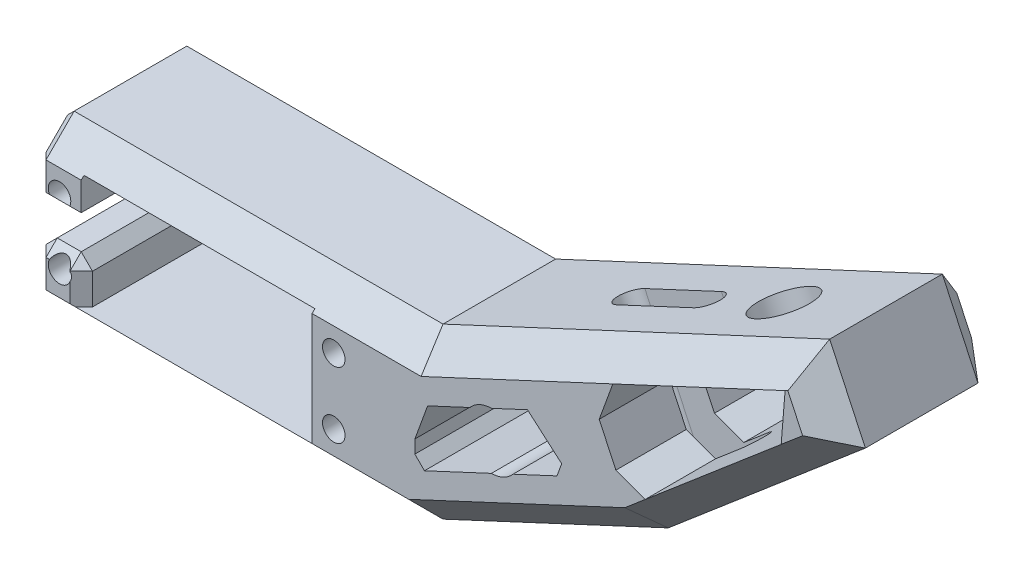
from build123d import *
from OCP.BRepFilletAPI import BRepFilletAPI_MakeChamfer

# Parameters (mm, degrees)
SKETCH1_W           = 57.5
SKETCH1_H           = 30
BOSS_EXTRUDE1_DEPTH = 30
SKETCH2_W           = 41
SKETCH2_H           = 21
CUT_EXTRUDE1_DEPTH  = 25
SKETCH8_R           = 2
CUT_EXTRUDE6_DEPTH  = 10
SKETCH9_W           = 8.25
SKETCH9_H           = 6
CUT_EXTRUDE7_DEPTH  = 25
SKETCH10_R          = 5
CUT_EXTRUDE8_DEPTH  = 10
BOSS_EXTRUDE4_DEPTH = 30
CUT_EXTRUDE9_DEPTH  = 30
CHAMFER3_SIZE       = 5
CHAMFER3_SIZE_2     = 7.15419636
CHAMFER3_SIZE_3     = 4.066852786
SKETCH16_R          = 5
CUT_EXTRUDE10_DEPTH = 30
CHAMFER5_SIZE       = 5
CHAMFER6_SIZE       = 2
CHAMFER7_SIZE       = 2.5
CHAMFER7_SIZE_2     = 1.767766953
CHAMFER8_SIZE       = 2.5
CHAMFER8_SIZE2      = 1.892599607
CHAMFER8_SIZE2_2    = 1.881218298
CHAMFER8_SIZE2_3    = 5.168604796
SKETCH19_R          = 5
CUT_EXTRUDE12_DEPTH = 30
SKETCH20_R          = 7.5
CUT_EXTRUDE13_DEPTH = 2.5


with BuildPart() as part:
    # Sketch1 → Boss-Extrude1 (new body)
    with BuildSketch(Plane.XY):
        Rectangle(SKETCH1_W, SKETCH1_H)
    extrude(amount=BOSS_EXTRUDE1_DEPTH)

    # Sketch2 → Cut-Extrude1 (cut)
    with BuildSketch(Plane.XY.offset(30)):
        Rectangle(SKETCH2_W, SKETCH2_H)
    extrude(amount=-CUT_EXTRUDE1_DEPTH, mode=Mode.SUBTRACT)

    # Sketch8 → Cut-Extrude6 (cut)
    with BuildSketch(Plane.XY.offset(30)):
        with Locations((24.35, 5.85)):
            Circle(SKETCH8_R)
        with Locations(Location((24.35, -5.85, 0), (0, 0, 180))):
            Circle(SKETCH8_R)
        with Locations((-24.35, -5.85)):
            Circle(SKETCH8_R)
        with Locations(Location((-24.35, 5.85, 0), (0, 0, 180))):
            Circle(SKETCH8_R)
    extrude(amount=-CUT_EXTRUDE6_DEPTH, mode=Mode.SUBTRACT)

    # Sketch9 → Cut-Extrude7 (cut)
    with BuildSketch(Plane.XY.offset(30)):
        with Locations((-24.625, 0)):
            Rectangle(SKETCH9_W, SKETCH9_H)
    extrude(amount=-CUT_EXTRUDE7_DEPTH, mode=Mode.SUBTRACT)

    # Sketch10 → Cut-Extrude8 (cut)
    with BuildSketch(Plane.XY.offset(5)):
        with Locations((-10, 0)):
            Circle(SKETCH10_R)
    extrude(amount=-CUT_EXTRUDE8_DEPTH, mode=Mode.SUBTRACT)

    # Sketch13 → Boss-Extrude4 (add)
    with BuildSketch(Plane.XY.offset(30)):
        Polygon((28.75, 15), (38.75, 15), (107.410726074, 47.017022383), (113.75, 33.422405577), (78.75, 3.652306326), (38.75, -15), (28.75, -15), align=None)
    extrude(amount=-BOSS_EXTRUDE4_DEPTH)

    # Sketch15 → Cut-Extrude9 (cut)
    with BuildSketch(Plane.XY.offset(30)):
        Polygon((38.75, 5), (38.75, 0), (38.75, -5), (66.25, 7.823460599), (58.75, 14.326153163), align=None)
        Polygon((76.558385836, 8.352238067), (69.372424662, 23.762581536), (104.992278447, 40.372392139), (107.608239852, 34.762444803), align=None)
    extrude(amount=-CUT_EXTRUDE9_DEPTH, mode=Mode.SUBTRACT)

    # Chamfer3
    # the kernel refuses this chamfer: 7.15419636, 5, 4.066852786 mm, written as the material it adds along each edge
    with BuildSketch(Plane(origin=(107.608239852, 34.762444803, 30), x_dir=(-0.7359660221939145, -0.6770184740286387, 0), z_dir=(0, 0, -1))) as chamfer3_piece_1:
        Polygon((CHAMFER3_SIZE * 0.999244403531, CHAMFER3_SIZE * 0.0388667211355), (-CHAMFER3_SIZE_2 * 0.302554433968, CHAMFER3_SIZE_2 * 0.953132107531), (0, 0), align=None)
    extrude(amount=30)
    with BuildSketch(Plane(origin=(69.372424662, 23.762581536, 30), x_dir=(0.8943448678110075, 0.4473782040065334, 0), z_dir=(0, 0, -1))) as chamfer3_piece_2:
        Polygon((CHAMFER3_SIZE * 0.999621916911, CHAMFER3_SIZE * 0.0274958766106), (-CHAMFER3_SIZE * 0.0274958766106, CHAMFER3_SIZE * 0.999621916911), (0, 0), align=None)
    extrude(amount=30)
    with BuildSketch(Plane(origin=(76.558385836, 8.352238067, 30), x_dir=(0.7880798878250118, 0.615572977319275, 0), z_dir=(0, 0, -1))) as chamfer3_piece_3:
        Polygon((CHAMFER3_SIZE_3 * 0.999130074634, -CHAMFER3_SIZE_3 * 0.0417024478214), (CHAMFER3_SIZE * 0.224841630528, -CHAMFER3_SIZE * 0.974395320792), (0, 0), align=None)
    extrude(amount=30)

    # Sketch16 → Cut-Extrude10 (cut)
    with BuildSketch(Plane(origin=(1.175656739, -2.521204013, 0), x_dir=(0.9063077870366488, 0.42261826174070183, 0), z_dir=(-0.42261826174070183, 0.9063077870366488, 0))):
        with Locations((97.217429724, -15)):
            Circle(SKETCH16_R)
        with BuildLine():
            Line((67.217429724, -12.5), (82.217429724, -12.5))
            ThreePointArc((82.217429724, -12.5), (84.717429724, -15), (82.217429724, -17.5))
            Line((82.217429724, -17.5), (67.217429724, -17.5))
            ThreePointArc((67.217429724, -17.5), (64.717429724, -15), (67.217429724, -12.5))
        make_face()
    extrude(amount=-CUT_EXTRUDE10_DEPTH, mode=Mode.SUBTRACT)

    # Chamfer5
    # the kernel refuses this chamfer: 5 mm, written as the material it takes off along each edge
    with BuildSketch(Plane(origin=(-28.75, 27.85841494, 0), x_dir=(-0.027495876610586313, 0, 0.9996219169112968), z_dir=(0, -1, 0))) as chamfer5_piece_1:
        Polygon((CHAMFER5_SIZE * 0.999621916911, -CHAMFER5_SIZE * 0.0274958766106), (-CHAMFER5_SIZE * 0.0274958766106, -CHAMFER5_SIZE * 0.999621916911), (0, 0), align=None)
    extrude(amount=55.71682988, mode=Mode.SUBTRACT)
    with BuildSketch(Plane(origin=(-41.60841494, -15, 0), x_dir=(0, -0.027495876610586317, 0.9996219169112968), z_dir=(1, 0, 0))) as chamfer5_piece_2:
        Polygon((CHAMFER5_SIZE * 0.999621916911, -CHAMFER5_SIZE * 0.0274958766106), (-CHAMFER5_SIZE * 0.0274958766106, -CHAMFER5_SIZE * 0.999621916911), (0, 0), align=None)
    extrude(amount=93.21682988, mode=Mode.SUBTRACT)
    with BuildSketch(Plane(origin=(90.403681589, 9.086507297, 30), x_dir=(-0.4224584769229525, 0.905965127389214, 0.02749587661058635), z_dir=(-0.9063077870366526, -0.4226182617406939, 0)), Plane(origin=(90.403681589, 9.086507297, 0), x_dir=(0.01162025957820246, -0.02491972708357306, 0.9996219169112968), z_dir=(-0.9063077870366526, -0.4226182617406939, 0))) as chamfer5_piece_3:
        Polygon((CHAMFER5_SIZE * 0.999621916911, CHAMFER5_SIZE * 0.0274958766106), (-CHAMFER5_SIZE * 0.0274958766106, CHAMFER5_SIZE * 0.999621916911), (0, 0), align=None)
    extrude(amount=69.851946638, mode=Mode.SUBTRACT)
    with BuildSketch(Plane(origin=(123.544555766, 41.753402643, 0), x_dir=(0.017814642661908332, -0.02094425308797373, 0.9996219169112968), z_dir=(-0.7617234170999287, -0.6479023351104763, 0)), Plane(origin=(123.544555766, 41.753402643, 30), x_dir=(-0.6476573741944397, 0.7614354223576539, 0.027495876610586372), z_dir=(-0.7617234170999287, -0.6479023351104763, 0))) as chamfer5_piece_4:
        Polygon((CHAMFER5_SIZE * 0.999621916911, CHAMFER5_SIZE * 0.0274958766106), (-CHAMFER5_SIZE * 0.0274958766106, CHAMFER5_SIZE * 0.999621916911), (0, 0), align=None)
    extrude(amount=71.665266299, mode=Mode.SUBTRACT)
    with BuildSketch(Plane(origin=(101.976525103, 58.670703972, 30), x_dir=(-0.9059651273892108, -0.42245847692295924, 0.027495876610586337), z_dir=(0.42261826174070055, -0.9063077870366495, 0)), Plane(origin=(101.976525103, 58.670703972, 0), x_dir=(0.024919727083572332, 0.011620259578202343, 0.9996219169112968), z_dir=(0.42261826174070055, -0.9063077870366495, 0))) as chamfer5_piece_5:
        Polygon((CHAMFER5_SIZE * 0.999621916911, CHAMFER5_SIZE * 0.0274958766106), (-CHAMFER5_SIZE * 0.0274958766106, CHAMFER5_SIZE * 0.999621916911), (0, 0), align=None)
    extrude(amount=40.71682988, mode=Mode.SUBTRACT)
    with BuildSketch(Plane(origin=(27.096318411, 9.565799029, 30), x_dir=(0.4224584769229604, -0.9059651273892103, 0.027495876610586324), z_dir=(0.9063077870366489, 0.4226182617407018, 0))) as chamfer5_piece_6_section:
        Polygon((CHAMFER5_SIZE * 0.999621916911, CHAMFER5_SIZE * 0.0274958766106), (-CHAMFER5_SIZE * 0.0274958766106, CHAMFER5_SIZE * 0.999621916911), (0, 0), align=None)
    chamfer5_piece_6 = extrude(amount=101.47555893, mode=Mode.PRIVATE)
    chamfer5_piece_6 = split(chamfer5_piece_6, bisect_by=Plane(origin=(81.150743587, 15, 28.329639499), z_dir=(0, 1, 0)), keep=Keep.TOP, mode=Mode.PRIVATE)
    add(chamfer5_piece_6, mode=Mode.SUBTRACT)
    with BuildSketch(Plane(origin=(27.096318411, 9.565799029, 0), x_dir=(-0.011620259578202905, 0.02491972708357345, 0.9996219169112968), z_dir=(0.9063077870366489, 0.4226182617407018, 0))) as chamfer5_piece_7_section:
        Polygon((CHAMFER5_SIZE * 0.999621916911, CHAMFER5_SIZE * 0.0274958766106), (-CHAMFER5_SIZE * 0.0274958766106, CHAMFER5_SIZE * 0.999621916911), (0, 0), align=None)
    chamfer5_piece_7 = extrude(amount=101.47555893, mode=Mode.PRIVATE)
    chamfer5_piece_7 = split(chamfer5_piece_7, bisect_by=Plane(origin=(81.150743587, 15, 1.670360501), z_dir=(0, 1, 0)), keep=Keep.TOP, mode=Mode.PRIVATE)
    add(chamfer5_piece_7, mode=Mode.SUBTRACT)
    with BuildSketch(Plane(origin=(-41.60841494, 15, 0), x_dir=(0, 0.027495876610586317, 0.9996219169112968), z_dir=(1, 0, 0))) as chamfer5_piece_8_section:
        Polygon((CHAMFER5_SIZE * 0.999621916911, CHAMFER5_SIZE * 0.0274958766106), (-CHAMFER5_SIZE * 0.0274958766106, CHAMFER5_SIZE * 0.999621916911), (0, 0), align=None)
    chamfer5_piece_8 = extrude(amount=93.21682988, mode=Mode.PRIVATE)
    chamfer5_piece_8 = split(chamfer5_piece_8, bisect_by=Plane(origin=(3.719146846, -1.335155097, 1.672660276), z_dir=(-0.4226182617407018, 0.9063077870366489, 0)), keep=Keep.TOP, mode=Mode.PRIVATE)
    add(chamfer5_piece_8, mode=Mode.SUBTRACT)
    with BuildSketch(Plane(origin=(51.60841494, -15, 30), x_dir=(0, 0.9996219169112968, 0.027495876610586355), z_dir=(-1, 0, 0))) as chamfer5_piece_9:
        Polygon((CHAMFER5_SIZE * 0.999621916911, CHAMFER5_SIZE * 0.0274958766106), (-CHAMFER5_SIZE * 0.0274958766106, CHAMFER5_SIZE * 0.999621916911), (0, 0), align=None)
    extrude(amount=93.21682988, mode=Mode.SUBTRACT)
    with BuildSketch(Plane(origin=(51.60841494, 15, 30), x_dir=(0, -0.9996219169112968, 0.02749587661058629), z_dir=(-1, 0, 0))) as chamfer5_piece_10_section:
        Polygon((CHAMFER5_SIZE * 0.999621916911, -CHAMFER5_SIZE * 0.0274958766106), (-CHAMFER5_SIZE * 0.0274958766106, -CHAMFER5_SIZE * 0.999621916911), (0, 0), align=None)
    chamfer5_piece_10 = extrude(amount=93.21682988, mode=Mode.PRIVATE)
    chamfer5_piece_10 = split(chamfer5_piece_10, bisect_by=Plane(origin=(3.719146846, -1.335155097, 28.327339724), z_dir=(-0.4226182617407018, 0.9063077870366489, 0)), keep=Keep.TOP, mode=Mode.PRIVATE)
    add(chamfer5_piece_10, mode=Mode.SUBTRACT)
    with BuildSketch(Plane(origin=(27.096318411, 9.565799029, 30), x_dir=(0.4224584769229604, -0.9059651273892103, 0.027495876610586324), z_dir=(0.9063077870366489, 0.4226182617407018, 0))) as chamfer5_piece_11a_section:
        Polygon((CHAMFER5_SIZE * 0.999621916911, CHAMFER5_SIZE * 0.0274958766106), (-CHAMFER5_SIZE * 0.0274958766106, CHAMFER5_SIZE * 0.999621916911), (0, 0), align=None)
    chamfer5_piece_11a = extrude(amount=101.47555893, mode=Mode.PRIVATE)
    chamfer5_piece_11a = split(chamfer5_piece_11a, bisect_by=Plane(origin=(35.512062488, 15, 28.462048788), z_dir=(0, -1, 0)), keep=Keep.TOP, mode=Mode.PRIVATE)
    with BuildSketch(Plane(origin=(51.60841494, 15, 30), x_dir=(0, -0.9996219169112968, 0.02749587661058629), z_dir=(-1, 0, 0))) as chamfer5_piece_11b_section:
        Polygon((CHAMFER5_SIZE * 0.999621916911, -CHAMFER5_SIZE * 0.0274958766106), (-CHAMFER5_SIZE * 0.0274958766106, -CHAMFER5_SIZE * 0.999621916911), (0, 0), align=None)
    chamfer5_piece_11b = extrude(amount=93.21682988, mode=Mode.PRIVATE)
    chamfer5_piece_11b = split(chamfer5_piece_11b, bisect_by=Plane(origin=(41.684567981, 16.368411523, 28.462048788), z_dir=(0.4226182617407018, -0.9063077870366489, 0)), keep=Keep.TOP, mode=Mode.PRIVATE)
    chamfer5_piece_11 = chamfer5_piece_11a & chamfer5_piece_11b
    add(chamfer5_piece_11, mode=Mode.SUBTRACT)
    with BuildSketch(Plane(origin=(27.096318411, 9.565799029, 0), x_dir=(-0.011620259578202905, 0.02491972708357345, 0.9996219169112968), z_dir=(0.9063077870366489, 0.4226182617407018, 0))) as chamfer5_piece_12a_section:
        Polygon((CHAMFER5_SIZE * 0.999621916911, CHAMFER5_SIZE * 0.0274958766106), (-CHAMFER5_SIZE * 0.0274958766106, CHAMFER5_SIZE * 0.999621916911), (0, 0), align=None)
    chamfer5_piece_12a = extrude(amount=101.47555893, mode=Mode.PRIVATE)
    chamfer5_piece_12a = split(chamfer5_piece_12a, bisect_by=Plane(origin=(35.512062488, 15, 1.537951212), z_dir=(0, -1, 0)), keep=Keep.TOP, mode=Mode.PRIVATE)
    with BuildSketch(Plane(origin=(-41.60841494, 15, 0), x_dir=(0, 0.027495876610586317, 0.9996219169112968), z_dir=(1, 0, 0))) as chamfer5_piece_12b_section:
        Polygon((CHAMFER5_SIZE * 0.999621916911, CHAMFER5_SIZE * 0.0274958766106), (-CHAMFER5_SIZE * 0.0274958766106, CHAMFER5_SIZE * 0.999621916911), (0, 0), align=None)
    chamfer5_piece_12b = extrude(amount=93.21682988, mode=Mode.PRIVATE)
    chamfer5_piece_12b = split(chamfer5_piece_12b, bisect_by=Plane(origin=(41.684567981, 16.368411523, 1.537951212), z_dir=(0.4226182617407018, -0.9063077870366489, 0)), keep=Keep.TOP, mode=Mode.PRIVATE)
    chamfer5_piece_12 = chamfer5_piece_12a & chamfer5_piece_12b
    add(chamfer5_piece_12, mode=Mode.SUBTRACT)

    # Chamfer6
    # the kernel refuses this chamfer: 2 mm, written as the material it takes off along each edge
    with BuildSketch(Plane(origin=(-21.833333333, -4.333333333, 28.666666667), x_dir=(0.7071067811865551, 2.5121479338940134e-15, -0.70710678118654), z_dir=(0.577350269189621, 0.5773502691896211, 0.5773502691896353)), Plane(origin=(-27.416666667, -4.333333333, 28.666666667), x_dir=(8.79251776862911e-15, 0.70710678118655, -0.7071067811865451), z_dir=(-0.5773502691896274, 0.5773502691896265, 0.5773502691896233))) as chamfer6_piece_1:
        Polygon((-1.414213562, -0.816496581), (1.414213562, -0.816496581), (0, 1.632993162), align=None)
    extrude(amount=2.540341184, mode=Mode.SUBTRACT)
    with BuildSketch(Plane(origin=(-27.416666667, 4.333333333, 28.666666667), x_dir=(-0.7071067811865468, 0.7071067811865483, 0), z_dir=(-0.5773502691896283, -0.577350269189627, 0.5773502691896221))) as chamfer6_piece_2:
        Polygon((-1.414213562, 0.816496581), (1.414213562, 0.816496581), (0, -1.632993162), align=None)
    extrude(amount=2.540341184, mode=Mode.SUBTRACT)
    with BuildSketch(Plane(origin=(-28.75, -15, -0.143365976), x_dir=(-0.027495876610585623, 0.9996219169112968, 0), z_dir=(0, 0, 1))) as chamfer6_piece_3:
        Polygon((CHAMFER6_SIZE * 0.999621916911, -CHAMFER6_SIZE * 0.0274958766106), (-CHAMFER6_SIZE * 0.0274958766106, -CHAMFER6_SIZE * 0.999621916911), (0, 0), align=None)
    extrude(amount=30.286731952, mode=Mode.SUBTRACT)
    with BuildSketch(Plane(origin=(-28.75, -6.36309104, 33.63690896), x_dir=(0.9996219169112968, -0.019442520806022014, 0.019442520806006464), z_dir=(0, -0.7071067811862648, -0.7071067811868302))) as chamfer6_piece_4:
        Polygon((CHAMFER6_SIZE * 0.999621916911, -CHAMFER6_SIZE * 0.0274958766106), (-CHAMFER6_SIZE * 0.0274958766106, -CHAMFER6_SIZE * 0.999621916911), (0, 0), align=None)
    extrude(amount=17.357799764, mode=Mode.SUBTRACT)
    with BuildSketch(Plane(origin=(-20.5, 2.143365976, 30), x_dir=(-0.9996219169112968, 0, 0.02749587661058522), z_dir=(0, -1, 0))) as chamfer6_piece_5_section:
        Polygon((CHAMFER6_SIZE * 0.999621916911, CHAMFER6_SIZE * 0.0274958766106), (-CHAMFER6_SIZE * 0.0274958766106, CHAMFER6_SIZE * 0.999621916911), (0, 0), align=None)
    chamfer6_piece_5 = extrude(amount=17.286731952, mode=Mode.PRIVATE)
    chamfer6_piece_5 = split(chamfer6_piece_5, bisect_by=Plane(origin=(-21.161947574, -10.5, 29.325063892), z_dir=(0, 1, 0)), keep=Keep.TOP, mode=Mode.PRIVATE)
    add(chamfer6_piece_5, mode=Mode.SUBTRACT)
    with BuildSketch(Plane(origin=(-28.75, 2.143365976, 30), x_dir=(0.9996219169112965, 0, 0.027495876610587746), z_dir=(0, -1, 0))) as chamfer6_piece_6:
        Polygon((CHAMFER6_SIZE * 0.999621916911, -CHAMFER6_SIZE * 0.0274958766106), (-CHAMFER6_SIZE * 0.0274958766106, -CHAMFER6_SIZE * 0.999621916911), (0, 0), align=None)
    extrude(amount=17.286731952, mode=Mode.SUBTRACT)
    with BuildSketch(Plane(origin=(-28.75, -3, 35.143365976), x_dir=(-0.027495876610585623, -0.9996219169112968, 0), z_dir=(0, 0, -1)), Plane(origin=(-20.5, 3, 35.143365976), x_dir=(0.027495876610585623, 0.9996219169112968, 0), z_dir=(0, 0, -1))) as chamfer6_piece_7:
        Polygon((CHAMFER6_SIZE * 0.999621916911, -CHAMFER6_SIZE * 0.0274958766106), (-CHAMFER6_SIZE * 0.0274958766106, -CHAMFER6_SIZE * 0.999621916911), (0, 0), align=None)
    extrude(amount=30.143365976, mode=Mode.SUBTRACT)
    with BuildSketch(Plane(origin=(-20.5, -3, 35.143365976), x_dir=(0.027495876610585623, -0.9996219169112968, 0), z_dir=(0, 0, -1)), Plane(origin=(-28.75, 3, 35.143365976), x_dir=(-0.027495876610585623, 0.9996219169112968, 0), z_dir=(0, 0, -1))) as chamfer6_piece_8:
        Polygon((CHAMFER6_SIZE * 0.999621916911, CHAMFER6_SIZE * 0.0274958766106), (-CHAMFER6_SIZE * 0.0274958766106, CHAMFER6_SIZE * 0.999621916911), (0, 0), align=None)
    extrude(amount=30.143365976, mode=Mode.SUBTRACT)
    with BuildSketch(Plane(origin=(-33.893365976, -3, 30), x_dir=(0, -0.9996219169112968, 0.027495876610585432), z_dir=(1, 0, 0)), Plane(origin=(-15.356634024, 3, 30), x_dir=(0, 0.9996219169112968, 0.027495876610585716), z_dir=(-1, 0, 0))) as chamfer6_piece_9:
        Polygon((CHAMFER6_SIZE * 0.999621916911, CHAMFER6_SIZE * 0.0274958766106), (-CHAMFER6_SIZE * 0.0274958766106, CHAMFER6_SIZE * 0.999621916911), (0, 0), align=None)
    extrude(amount=18.536731952, mode=Mode.SUBTRACT)
    with BuildSketch(Plane(origin=(-28.75, 15, -0.143365976), x_dir=(-0.027495876610585623, -0.9996219169112968, 0), z_dir=(0, 0, 1))) as chamfer6_piece_10:
        Polygon((CHAMFER6_SIZE * 0.999621916911, CHAMFER6_SIZE * 0.0274958766106), (-CHAMFER6_SIZE * 0.0274958766106, CHAMFER6_SIZE * 0.999621916911), (0, 0), align=None)
    extrude(amount=30.286731952, mode=Mode.SUBTRACT)
    with BuildSketch(Plane(origin=(-28.75, 6.36309104, 33.63690896), x_dir=(0.9996219169112968, 0.019442520806021366, 0.019442520806005816), z_dir=(0, 0.7071067811862648, -0.7071067811868302))) as chamfer6_piece_11:
        Polygon((CHAMFER6_SIZE * 0.999621916911, CHAMFER6_SIZE * 0.0274958766106), (-CHAMFER6_SIZE * 0.0274958766106, CHAMFER6_SIZE * 0.999621916911), (0, 0), align=None)
    extrude(amount=17.357799764, mode=Mode.SUBTRACT)
    with BuildSketch(Plane(origin=(-28.75, 15.143365976, 30), x_dir=(-0.0274958766105856, 0, -0.9996219169112968), z_dir=(0, -1, 0))) as chamfer6_piece_12:
        Polygon((CHAMFER6_SIZE * 0.999621916911, CHAMFER6_SIZE * 0.0274958766106), (-CHAMFER6_SIZE * 0.0274958766106, CHAMFER6_SIZE * 0.999621916911), (0, 0), align=None)
    extrude(amount=17.286731952, mode=Mode.SUBTRACT)

    # Chamfer7
    # the kernel refuses this chamfer: 2.5, 1.767766953 mm, written as the material it adds along each edge
    # the kernel refuses this chamfer: 2.5, 1.767766953 mm, written as the material it takes off along each edge
    with BuildSketch(Plane(origin=(-28.75, 5, 5), x_dir=(0.9996219169112968, 0, 0.027495876610586317), z_dir=(0, -1, 0))) as chamfer7_2_piece_1_section:
        Polygon((CHAMFER7_SIZE * 0.999621916911, -CHAMFER7_SIZE * 0.0274958766106), (CHAMFER7_SIZE_2 * 0.687396915251, -CHAMFER7_SIZE_2 * 0.726281956863), (0, 0), align=None)
    chamfer7_2_piece_1 = extrude(amount=10, mode=Mode.PRIVATE)
    chamfer7_2_piece_1 = split(chamfer7_2_piece_1, bisect_by=Plane(origin=(-27.555267467, 3.805267467, 4.588427948), z_dir=(-0.7071067811862649, -0.7071067811868302, 0)), keep=Keep.TOP, mode=Mode.PRIVATE)
    chamfer7_2_piece_1 = split(chamfer7_2_piece_1, bisect_by=Plane(origin=(-24.018422489, -0.268422489, 4.588427948), z_dir=(-0.7071067811862649, 0.7071067811868302, 0)), keep=Keep.TOP, mode=Mode.PRIVATE)
    add(chamfer7_2_piece_1, mode=Mode.SUBTRACT)
    with BuildSketch(Plane(origin=(-28.75, 5, 5), x_dir=(0.9996219169112968, 0, 0.027495876610586317), z_dir=(0, -1, 0))) as chamfer7_2_piece_2_section:
        Polygon((CHAMFER7_SIZE * 0.999621916911, -CHAMFER7_SIZE * 0.0274958766106), (CHAMFER7_SIZE_2 * 0.687396915251, -CHAMFER7_SIZE_2 * 0.726281956863), (0, 0), align=None)
    chamfer7_2_piece_2 = extrude(amount=10, mode=Mode.PRIVATE)
    chamfer7_2_piece_2 = split(chamfer7_2_piece_2, bisect_by=Plane(origin=(-26.5, -3, 4.875), z_dir=(0, 1, 0)), keep=Keep.TOP, mode=Mode.PRIVATE)
    chamfer7_2_piece_2 = split(chamfer7_2_piece_2, bisect_by=Plane(origin=(-26.5, 3, 4.875), z_dir=(0, -1, 0)), keep=Keep.TOP, mode=Mode.PRIVATE)
    add(chamfer7_2_piece_2, mode=Mode.SUBTRACT)

    # Chamfer8: one chamfer whose edges measure the first distance from different faces: ONE call of the kernel's chamfer builder (chamfer() names one face for all edges)
    chamfer8_edges_1 = [part.edges().sort_by_distance(p)[0] for p in [
        (66.25, 7.823460599, 15),
    ]]
    chamfer8_side_1 = [part.faces().sort_by_distance(p)[0] for p in [
        (52.5, 1.4117303, 15),
    ]]
    chamfer8_edges_2 = [part.edges().sort_by_distance(p)[0] for p in [
        (38.75, -5, 15),
    ]]
    chamfer8_side_2 = [part.faces().sort_by_distance(p)[0] for p in [
        (38.75, 0, 15),
    ]]
    chamfer8_edges_3 = [part.edges().sort_by_distance(p)[0] for p in [
        (38.75, 5, 15),
    ]]
    chamfer8_side_3 = [part.faces().sort_by_distance(p)[0] for p in [
        (48.75, 9.663076582, 15),
    ]]
    chamfer8 = BRepFilletAPI_MakeChamfer(part.part.solid().wrapped)
    for e in chamfer8_edges_1:
        chamfer8.Add(CHAMFER8_SIZE, CHAMFER8_SIZE2, e.wrapped, chamfer8_side_1[0].wrapped)  # the first distance lies on this face
    for e in chamfer8_edges_2:
        chamfer8.Add(CHAMFER8_SIZE, CHAMFER8_SIZE2_2, e.wrapped, chamfer8_side_2[0].wrapped)  # the first distance lies on this face
    for e in chamfer8_edges_3:
        chamfer8.Add(CHAMFER8_SIZE, CHAMFER8_SIZE2_3, e.wrapped, chamfer8_side_3[0].wrapped)  # the first distance lies on this face
    add(Compound.cast(chamfer8.Shape()), mode=Mode.REPLACE)

    # Sketch19 → Cut-Extrude12 (cut)
    with BuildSketch(Plane.XY.offset(30)):
        with Locations((52.344616806, 6.339273926)):
            Circle(SKETCH19_R)
    extrude(amount=-CUT_EXTRUDE12_DEPTH, mode=Mode.SUBTRACT)

    # Sketch20 → Cut-Extrude13 (cut)
    with BuildSketch(Plane.XY.offset(5)):
        with Locations((-10, 0)):
            Circle(SKETCH20_R)
    extrude(amount=-CUT_EXTRUDE13_DEPTH, mode=Mode.SUBTRACT)


solid = part.part
